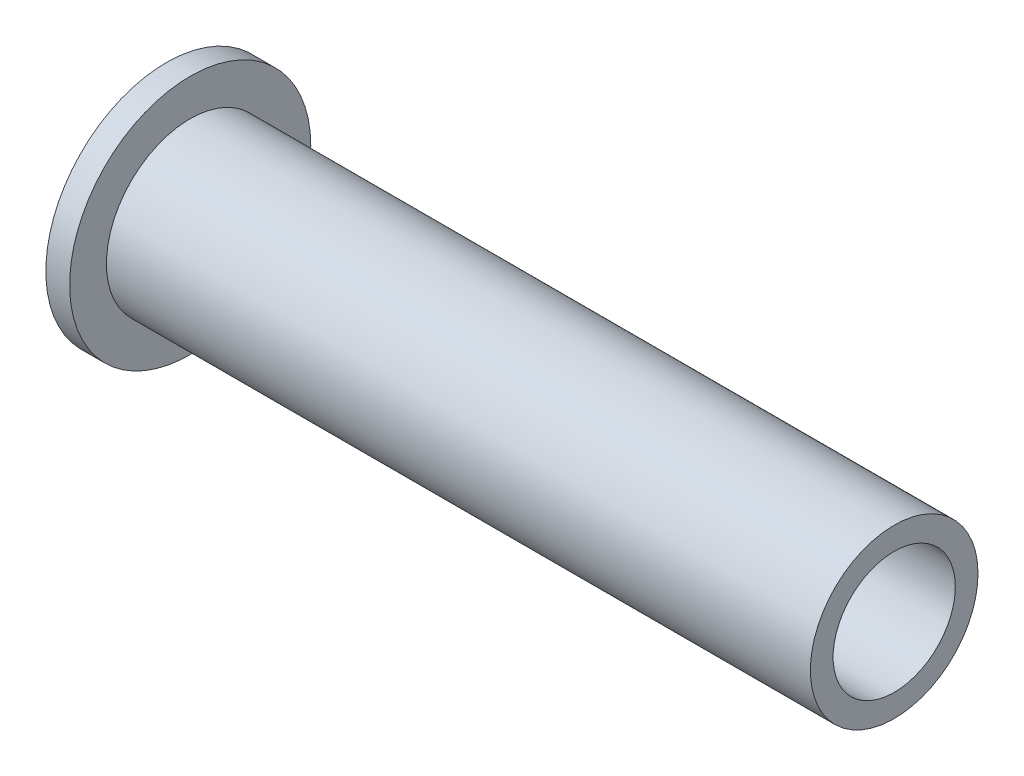
from build123d import *

# Parameters (mm, degrees)
CUT_EXTRUDE1_DEPTH        = 0.762
F_6_40_TAPPED_HOLE1_D     = 2.8702
F_6_40_TAPPED_HOLE1_DEPTH = 9.652
F_6_40_TAPPED_HOLE1_TIP   = 0.862295074


with BuildPart() as part:
    # Sketch1 → Revolve1 (revolve)
    with BuildSketch(Plane.XY):
        Polygon((0, 0), (17.0942, 0), (17.0942, 1.9685), (0.5588, 1.9685), (0.5588, 2.8321), (0, 2.8321), align=None)
    revolve(axis=Axis((0, 0, 0), (-1, 0, 0)))

    # Sketch2 → Cut-Extrude1 (cut)
    with BuildSketch(Plane.ZY):
        Polygon((-1.539793168, 0.889), (-1.047924283, 0), (-1.561763732, -0.876484467), (-0.546769057, -0.921670859), (0, -1.778), (0.523962141, -0.90752905), (1.539793168, -0.889), (1.047924283, 0), (1.539793168, 0.889), (0.523962141, 0.90752905), (0, 1.778), (-0.523962141, 0.90752905), align=None)
    extrude(amount=-CUT_EXTRUDE1_DEPTH, mode=Mode.SUBTRACT)

    # #6-40 Tapped Hole1
    with Locations(Plane(origin=(17.0942, 0, 0), x_dir=(0, 0, -1), z_dir=(1, 0, 0))):
        with Locations((0, 0)):
            Hole(F_6_40_TAPPED_HOLE1_D / 2, depth=F_6_40_TAPPED_HOLE1_DEPTH)
            with Locations((0, 0, -(F_6_40_TAPPED_HOLE1_DEPTH + F_6_40_TAPPED_HOLE1_TIP / 2))):  # 118° drill point
                Cone(0, F_6_40_TAPPED_HOLE1_D / 2, F_6_40_TAPPED_HOLE1_TIP, mode=Mode.SUBTRACT)


solid = part.part
